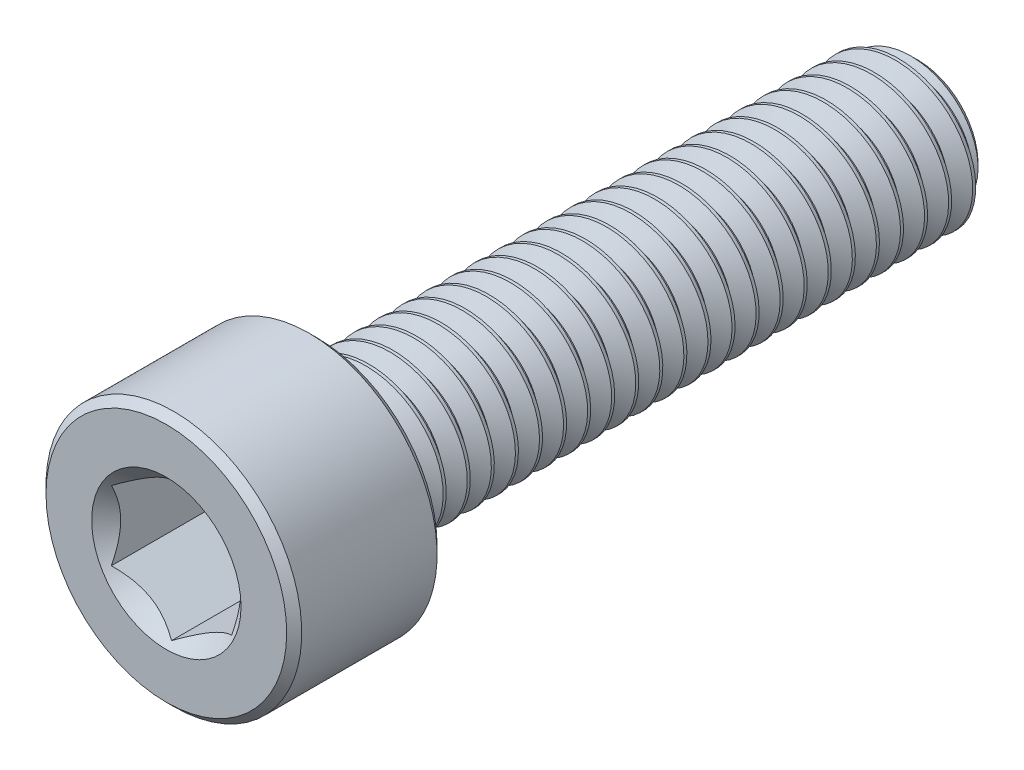
from build123d import *

# Parameters (mm, degrees)
CUT_EXTRUDE1_DEPTH     = 4
SPLIT1_SURFACE_1_BACK  = 28.74
SPLIT1_SURFACE_1_DEPTH = 57.48
SPLIT1_SURFACE_2_BACK  = 28.74
SPLIT1_SURFACE_2_DEPTH = 57.48
CUT_SWEEP1_PITCH       = 0.8
CUT_SWEEP1_TO          = 19.75


with BuildPart() as part:
    # Sketch2 → Revolve1 (revolve)
    with BuildSketch(Plane(origin=(0, 0, 0), x_dir=(0, 0, -1), z_dir=(1, 0, 0))):
        with BuildLine():
            Line((-12.5, 0), (-12.5, 4))
            Line((-12.5, 4), (-12.25, 4.25))
            Line((-12.25, 4.25), (-7.75, 4.25))
            Line((-7.75, 4.25), (-7.5, 4))
            Line((-7.5, 4), (-7.5, 2.75))
            ThreePointArc((-7.5, 2.75), (-7.426776695, 2.573223305), (-7.25, 2.5))
            Line((-7.25, 2.5), (11.980384758, 2.5))
            Line((11.980384758, 2.5), (12.5, 1.980384758))
            Line((12.5, 1.980384758), (12.5, 0))
            Line((12.5, 0), (-12.5, 0))
        make_face()
    revolve(axis=Axis((0, 0, -12.5), (0, 0, 1)))

    # Sketch3 → Cut-Extrude1 (cut)
    with BuildSketch(Plane.XY.offset(12.5)):
        Polygon((2, -1.154700538), (2, 1.154700538), (0, 2.309401077), (-2, 1.154700538), (-2, -1.154700538), (0, -2.309401077), align=None)
    extrude(amount=-CUT_EXTRUDE1_DEPTH, mode=Mode.SUBTRACT)

    # Cut-Extrude2 cone 1 section (through the dimple's axis) → Cut-Extrude2 (revolve, cut)
    with BuildSketch(Plane(origin=(0, 0, 12.5), x_dir=(0, -1, 0), z_dir=(1, 0, 0))):
        Polygon((0, 0), (2.482606158, 0), (0, 2.482606158), align=None)
    revolve(axis=Axis((0, 0, 12.5), (0, 0, -1)), mode=Mode.SUBTRACT)


with BuildPart() as body_2:
    # Split1: the piece behind the surface
    add(part.part)
    # Split1 surface: a surface, the sketch's curves swept straight by 57.48 mm
    with BuildLine(Plane(origin=(0, 0, 0), x_dir=(0, 0, -1), z_dir=(1, 0, 0)).offset(-SPLIT1_SURFACE_1_BACK), mode=Mode.PRIVATE) as split1_surface_1_path:
        Line((-7.25, -4.25), (-7.25, 4.25))
    split1_surface_1 = Shell.extrude(split1_surface_1_path.wire(), (1 * SPLIT1_SURFACE_1_DEPTH, 0 * SPLIT1_SURFACE_1_DEPTH, 0 * SPLIT1_SURFACE_1_DEPTH))
    split(bisect_by=split1_surface_1, keep=Keep.BOTTOM)

    # Cut-Sweep1: arcs per turn and ends read off the stored shape
    # Cut-Sweep1: the profile of Sketch7 screwed along a right-hand helix through 26 turns, 8 arcs to a turn; built about Z, then put on its axis
    cut_sweep1_z = Axis((0, 0, 0), (0, 0, 1))
    cut_sweep1_corners = [(2.54330127, 0, 0.025), (2.54330127, 0, -0.725), (1.980384758, 0, -0.4), (1.980384758, 0, -0.3)]
    with BuildLine(mode=Mode.PRIVATE) as cut_sweep1_profile:
        Line(cut_sweep1_corners[0], cut_sweep1_corners[1])
        Line(cut_sweep1_corners[1], cut_sweep1_corners[2])
        Line(cut_sweep1_corners[2], cut_sweep1_corners[3])
        Line(cut_sweep1_corners[3], cut_sweep1_corners[0])
    cut_sweep1_cap = Face(cut_sweep1_profile.wire())
    cut_sweep1_turn_angles = [0, 22.5, 45, 67.5, 90, 112.5, 135, 157.5, 180, 202.5, 225, 247.5, 270, 292.5, 315, 337.5, 360]
    cut_sweep1_turn_weights = [1, 0.9238795325112867, 1, 0.9238795325112867, 1, 0.9238795325112867, 1, 0.9238795325112867, 1, 0.9238795325112867, 1, 0.9238795325112867, 1, 0.9238795325112867, 1, 0.9238795325112867, 1]
    cut_sweep1_turn_rails = [Edge.make_bspline([Vector(p[0], p[1], 0).rotate(cut_sweep1_z, cut_sweep1_turn_angles[k]) / cut_sweep1_turn_weights[k] + Vector(0, 0, p[2] + CUT_SWEEP1_PITCH * cut_sweep1_turn_angles[k] / 360) for k in range(17)], [0, 0, 0, 1, 1, 2, 2, 3, 3, 4, 4, 5, 5, 6, 6, 7, 7, 8, 8, 8], 2, cut_sweep1_turn_weights) for p in cut_sweep1_corners]
    cut_sweep1_turn_sides = [Face.make_surface_from_curves(cut_sweep1_turn_rails[p[0]], cut_sweep1_turn_rails[p[1]]) for p in [(0, 1), (1, 2), (2, 3), (3, 0)]]
    cut_sweep1 = Plane(origin=(0, 0, -12.5), x_dir=(0, 1, 0), z_dir=(0, 0, 1)) * split(Solid(Shell([*[p.moved(Location((0, 0, CUT_SWEEP1_PITCH * i))) for i in range(26) for p in cut_sweep1_turn_sides], cut_sweep1_cap, cut_sweep1_cap.rotate(cut_sweep1_z, 9360).moved(Location((0, 0, CUT_SWEEP1_PITCH * 9360 / 360)))])), bisect_by=Plane.XY.offset(CUT_SWEEP1_TO), keep=Keep.BOTTOM, mode=Mode.PRIVATE)
    add(cut_sweep1, mode=Mode.SUBTRACT)


with BuildPart() as part_1:
    add(part.part)

    # Split1: split by a surface, the side it looks to stays
    # Split1 surface: a surface, the sketch's curves swept straight by 57.48 mm
    with BuildLine(Plane(origin=(0, 0, 0), x_dir=(0, 0, -1), z_dir=(1, 0, 0)).offset(-SPLIT1_SURFACE_2_BACK), mode=Mode.PRIVATE) as split1_surface_2_path:
        Line((-7.25, -4.25), (-7.25, 4.25))
    split1_surface_2 = Shell.extrude(split1_surface_2_path.wire(), (1 * SPLIT1_SURFACE_2_DEPTH, 0 * SPLIT1_SURFACE_2_DEPTH, 0 * SPLIT1_SURFACE_2_DEPTH))
    split(bisect_by=split1_surface_2, keep=Keep.TOP)

    add(body_2.part)  # Revolve2 merges body 2
    # Sketch8 → Revolve2 (revolve)
    with BuildSketch(Plane(origin=(0, 0, 0), x_dir=(0, 0, -1), z_dir=(1, 0, 0)), mode=Mode.PRIVATE) as revolve2_sk:
        Polygon((-7.5, 0), (-7.5, 2.5), (-7.25, 2.5), (-5.806624327, 0), align=None)
    revolve(revolve2_sk.sketch.rotate(Axis((0, 0, 5.806624327), (0, 0, 1)), 270), axis=Axis((0, 0, 5.806624327), (0, 0, 1)))


solid = part_1.part
